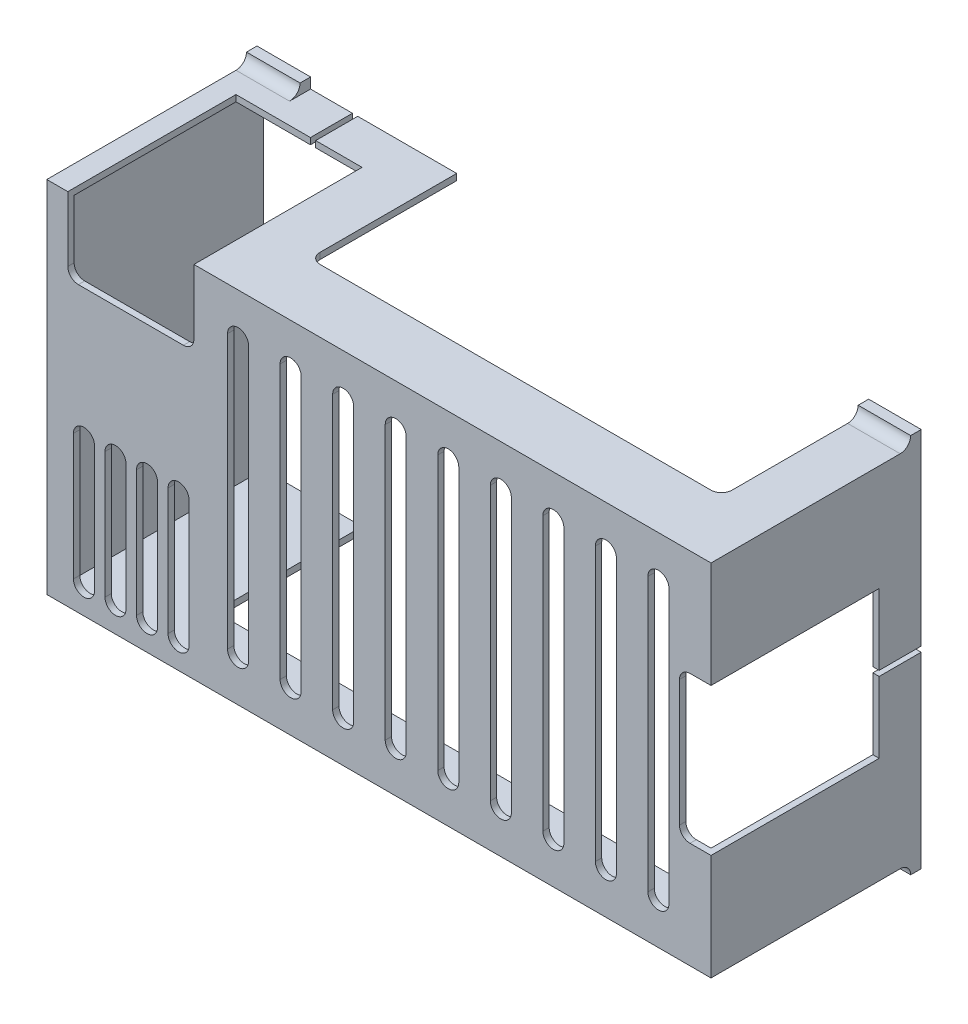
from build123d import *

# Parameters (mm, degrees)
SKETCH_1_W          = 126.4
SKETCH_1_H          = 68.4
SKETCH_1_W_2        = 124
SKETCH_1_H_2        = 66
EXTRUDE_1_DEPTH     = 40
SKETCH_2_W          = 126.4
SKETCH_2_H          = 68.4
EXTRUDE_1_2_DEPTH   = 1.2
CUT_EXTRUDE_1_DEPTH = 32
CUT_EXTRUDE_2_REACH = 84.243
CUT_EXTRUDE_3_DEPTH = 32
CUT_EXTRUDE_4_REACH = 103.355
CUT_EXTRUDE_5_REACH = 103.355
SKETCH_8_W          = 10
SKETCH_8_H          = 2
SKETCH_8_W_2        = 10.194480457
EXTRUDE_2_DEPTH     = 2
FILLET_1_R          = 2
CUT_EXTRUDE_6_REACH = 139.431
SKETCH_9_W          = 16
SKETCH_9_H          = 1
CUT_EXTRUDE_7_REACH = 104.715
SKETCH_10_W         = 1
SKETCH_10_H         = 16


with BuildPart() as part:
    # Эскиз1 → Extrude 1 (new body)
    with BuildSketch(Plane.XY):
        Rectangle(SKETCH_1_W, SKETCH_1_H)
        Rectangle(SKETCH_1_W_2, SKETCH_1_H_2, mode=Mode.SUBTRACT)
    extrude(amount=EXTRUDE_1_DEPTH)

    # Эскиз2 → Extrude 1 2 (add)
    with BuildSketch(Plane.XY.offset(40)):
        Rectangle(SKETCH_2_W, SKETCH_2_H)
    extrude(amount=-EXTRUDE_1_2_DEPTH)

    # Эскиз3 → Вырез-Вытянуть1 (cut)
    with BuildSketch(Plane.XY.offset(40)):
        with BuildLine():
            Line((59.2, -14), (69.2, -14))
            Line((69.2, -14), (69.2, 14))
            Line((69.2, 14), (59.2, 14))
            ThreePointArc((59.2, 14), (57.785786438, 13.414213562), (57.2, 12))
            Line((57.2, 12), (57.2, -12))
            ThreePointArc((57.2, -12), (57.785786438, -13.414213562), (59.2, -14))
        make_face()
    extrude(amount=-CUT_EXTRUDE_1_DEPTH, mode=Mode.SUBTRACT)

    # Эскиз4 → Вырез-Вытянуть2 (cut, up to next)
    with BuildSketch(Plane.XY.offset(40), mode=Mode.PRIVATE) as cut_extrude_2_sk1:
        with BuildLine():
            Line((51.2, -26), (51.2, 26))
            ThreePointArc((51.2, 26), (53.2, 28), (55.2, 26))
            Line((55.2, 26), (55.2, -26))
            ThreePointArc((55.2, -26), (53.2, -28), (51.2, -26))
        make_face()
    cut_extrude_2_tool1 = extrude(cut_extrude_2_sk1.sketch, amount=-CUT_EXTRUDE_2_REACH, mode=Mode.PRIVATE) & part.part
    # Эскиз4 → Вырез-Вытянуть2 (cut, up to next)
    with BuildSketch(Plane.XY.offset(40), mode=Mode.PRIVATE) as cut_extrude_2_sk2:
        with BuildLine():
            Line((41.2, -26), (41.2, 26))
            ThreePointArc((41.2, 26), (43.2, 28), (45.2, 26))
            Line((45.2, 26), (45.2, -26))
            ThreePointArc((45.2, -26), (43.2, -28), (41.2, -26))
        make_face()
    cut_extrude_2_tool2 = extrude(cut_extrude_2_sk2.sketch, amount=-CUT_EXTRUDE_2_REACH, mode=Mode.PRIVATE) & part.part
    # Эскиз4 → Вырез-Вытянуть2 (cut, up to next)
    with BuildSketch(Plane.XY.offset(40), mode=Mode.PRIVATE) as cut_extrude_2_sk3:
        with BuildLine():
            Line((31.2, -26), (31.2, 26))
            ThreePointArc((31.2, 26), (33.2, 28), (35.2, 26))
            Line((35.2, 26), (35.2, -26))
            ThreePointArc((35.2, -26), (33.2, -28), (31.2, -26))
        make_face()
    cut_extrude_2_tool3 = extrude(cut_extrude_2_sk3.sketch, amount=-CUT_EXTRUDE_2_REACH, mode=Mode.PRIVATE) & part.part
    # Эскиз4 → Вырез-Вытянуть2 (cut, up to next)
    with BuildSketch(Plane.XY.offset(40), mode=Mode.PRIVATE) as cut_extrude_2_sk4:
        with BuildLine():
            Line((21.2, -26), (21.2, 26))
            ThreePointArc((21.2, 26), (23.2, 28), (25.2, 26))
            Line((25.2, 26), (25.2, -26))
            ThreePointArc((25.2, -26), (23.2, -28), (21.2, -26))
        make_face()
    cut_extrude_2_tool4 = extrude(cut_extrude_2_sk4.sketch, amount=-CUT_EXTRUDE_2_REACH, mode=Mode.PRIVATE) & part.part
    # Эскиз4 → Вырез-Вытянуть2 (cut, up to next)
    with BuildSketch(Plane.XY.offset(40), mode=Mode.PRIVATE) as cut_extrude_2_sk5:
        with BuildLine():
            Line((11.2, -26), (11.2, 26))
            ThreePointArc((11.2, 26), (13.2, 28), (15.2, 26))
            Line((15.2, 26), (15.2, -26))
            ThreePointArc((15.2, -26), (13.2, -28), (11.2, -26))
        make_face()
    cut_extrude_2_tool5 = extrude(cut_extrude_2_sk5.sketch, amount=-CUT_EXTRUDE_2_REACH, mode=Mode.PRIVATE) & part.part
    # Эскиз4 → Вырез-Вытянуть2 (cut, up to next)
    with BuildSketch(Plane.XY.offset(40), mode=Mode.PRIVATE) as cut_extrude_2_sk6:
        with BuildLine():
            Line((1.2, -26), (1.2, 26))
            ThreePointArc((1.2, 26), (3.2, 28), (5.2, 26))
            Line((5.2, 26), (5.2, -26))
            ThreePointArc((5.2, -26), (3.2, -28), (1.2, -26))
        make_face()
    cut_extrude_2_tool6 = extrude(cut_extrude_2_sk6.sketch, amount=-CUT_EXTRUDE_2_REACH, mode=Mode.PRIVATE) & part.part
    # Эскиз4 → Вырез-Вытянуть2 (cut, up to next)
    with BuildSketch(Plane.XY.offset(40), mode=Mode.PRIVATE) as cut_extrude_2_sk7:
        with BuildLine():
            Line((-8.8, -26), (-8.8, 26))
            ThreePointArc((-8.8, 26), (-6.8, 28), (-4.8, 26))
            Line((-4.8, 26), (-4.8, -26))
            ThreePointArc((-4.8, -26), (-6.8, -28), (-8.8, -26))
        make_face()
    cut_extrude_2_tool7 = extrude(cut_extrude_2_sk7.sketch, amount=-CUT_EXTRUDE_2_REACH, mode=Mode.PRIVATE) & part.part
    # Эскиз4 → Вырез-Вытянуть2 (cut, up to next)
    with BuildSketch(Plane.XY.offset(40), mode=Mode.PRIVATE) as cut_extrude_2_sk8:
        with BuildLine():
            Line((-18.8, -26), (-18.8, 26))
            ThreePointArc((-18.8, 26), (-16.8, 28), (-14.8, 26))
            Line((-14.8, 26), (-14.8, -26))
            ThreePointArc((-14.8, -26), (-16.8, -28), (-18.8, -26))
        make_face()
    cut_extrude_2_tool8 = extrude(cut_extrude_2_sk8.sketch, amount=-CUT_EXTRUDE_2_REACH, mode=Mode.PRIVATE) & part.part
    # Эскиз4 → Вырез-Вытянуть2 (cut, up to next)
    with BuildSketch(Plane.XY.offset(40), mode=Mode.PRIVATE) as cut_extrude_2_sk9:
        with BuildLine():
            Line((-28.8, -26), (-28.8, 26))
            ThreePointArc((-28.8, 26), (-26.8, 28), (-24.8, 26))
            Line((-24.8, 26), (-24.8, -26))
            ThreePointArc((-24.8, -26), (-26.8, -28), (-28.8, -26))
        make_face()
    cut_extrude_2_tool9 = extrude(cut_extrude_2_sk9.sketch, amount=-CUT_EXTRUDE_2_REACH, mode=Mode.PRIVATE) & part.part
    # Эскиз4 → Вырез-Вытянуть2 (cut, up to next)
    with BuildSketch(Plane.XY.offset(40), mode=Mode.PRIVATE) as cut_extrude_2_sk10:
        with BuildLine():
            Line((-40.127823637, -29.1), (-40.127823637, -5.1))
            ThreePointArc((-40.127823637, -5.1), (-38.127823637, -3.1), (-36.127823637, -5.1))
            Line((-36.127823637, -5.1), (-36.127823637, -29.1))
            ThreePointArc((-36.127823637, -29.1), (-38.127823637, -31.1), (-40.127823637, -29.1))
        make_face()
    cut_extrude_2_tool10 = extrude(cut_extrude_2_sk10.sketch, amount=-CUT_EXTRUDE_2_REACH, mode=Mode.PRIVATE) & part.part
    # Эскиз4 → Вырез-Вытянуть2 (cut, up to next)
    with BuildSketch(Plane.XY.offset(40), mode=Mode.PRIVATE) as cut_extrude_2_sk11:
        with BuildLine():
            Line((-46.127823637, -29.1), (-46.127823637, -5.1))
            ThreePointArc((-46.127823637, -5.1), (-44.127823637, -3.1), (-42.127823637, -5.1))
            Line((-42.127823637, -5.1), (-42.127823637, -29.1))
            ThreePointArc((-42.127823637, -29.1), (-44.127823637, -31.1), (-46.127823637, -29.1))
        make_face()
    cut_extrude_2_tool11 = extrude(cut_extrude_2_sk11.sketch, amount=-CUT_EXTRUDE_2_REACH, mode=Mode.PRIVATE) & part.part
    # Эскиз4 → Вырез-Вытянуть2 (cut, up to next)
    with BuildSketch(Plane.XY.offset(40), mode=Mode.PRIVATE) as cut_extrude_2_sk12:
        with BuildLine():
            Line((-52.127823637, -29.1), (-52.127823637, -5.1))
            ThreePointArc((-52.127823637, -5.1), (-50.127823637, -3.1), (-48.127823637, -5.1))
            Line((-48.127823637, -5.1), (-48.127823637, -29.1))
            ThreePointArc((-48.127823637, -29.1), (-50.127823637, -31.1), (-52.127823637, -29.1))
        make_face()
    cut_extrude_2_tool12 = extrude(cut_extrude_2_sk12.sketch, amount=-CUT_EXTRUDE_2_REACH, mode=Mode.PRIVATE) & part.part
    # Эскиз4 → Вырез-Вытянуть2 (cut, up to next)
    with BuildSketch(Plane.XY.offset(40), mode=Mode.PRIVATE) as cut_extrude_2_sk13:
        with BuildLine():
            Line((-58.127823637, -29.1), (-58.127823637, -5.1))
            ThreePointArc((-58.127823637, -5.1), (-56.127823637, -3.1), (-54.127823637, -5.1))
            Line((-54.127823637, -5.1), (-54.127823637, -29.1))
            ThreePointArc((-54.127823637, -29.1), (-56.127823637, -31.1), (-58.127823637, -29.1))
        make_face()
    cut_extrude_2_tool13 = extrude(cut_extrude_2_sk13.sketch, amount=-CUT_EXTRUDE_2_REACH, mode=Mode.PRIVATE) & part.part
    add(cut_extrude_2_tool1.solids().sort_by_distance((53.2, 0, 40))[0], mode=Mode.SUBTRACT)
    add(cut_extrude_2_tool2.solids().sort_by_distance((43.2, 0, 40))[0], mode=Mode.SUBTRACT)
    add(cut_extrude_2_tool3.solids().sort_by_distance((33.2, 0, 40))[0], mode=Mode.SUBTRACT)
    add(cut_extrude_2_tool4.solids().sort_by_distance((23.2, 0, 40))[0], mode=Mode.SUBTRACT)
    add(cut_extrude_2_tool5.solids().sort_by_distance((13.2, 0, 40))[0], mode=Mode.SUBTRACT)
    add(cut_extrude_2_tool6.solids().sort_by_distance((3.2, 0, 40))[0], mode=Mode.SUBTRACT)
    add(cut_extrude_2_tool7.solids().sort_by_distance((-6.8, 0, 40))[0], mode=Mode.SUBTRACT)
    add(cut_extrude_2_tool8.solids().sort_by_distance((-16.8, 0, 40))[0], mode=Mode.SUBTRACT)
    add(cut_extrude_2_tool9.solids().sort_by_distance((-26.8, 0, 40))[0], mode=Mode.SUBTRACT)
    add(cut_extrude_2_tool10.solids().sort_by_distance((-38.127824, -17.1, 40))[0], mode=Mode.SUBTRACT)
    add(cut_extrude_2_tool11.solids().sort_by_distance((-44.127824, -17.1, 40))[0], mode=Mode.SUBTRACT)
    add(cut_extrude_2_tool12.solids().sort_by_distance((-50.127824, -17.1, 40))[0], mode=Mode.SUBTRACT)
    add(cut_extrude_2_tool13.solids().sort_by_distance((-56.127824, -17.1, 40))[0], mode=Mode.SUBTRACT)

    # Эскиз5 → Вырез-Вытянуть3 (cut)
    with BuildSketch(Plane.XY.offset(40)):
        with BuildLine():
            Line((-59.2, 48.521499027), (-35.2, 48.521499027))
            Line((-35.2, 48.521499027), (-35.2, 21.878500973))
            ThreePointArc((-35.2, 21.878500973), (-35.785786438, 20.46428741), (-37.2, 19.878500973))
            Line((-37.2, 19.878500973), (-57.2, 19.878500973))
            ThreePointArc((-57.2, 19.878500973), (-58.614213562, 20.46428741), (-59.2, 21.878500973))
            Line((-59.2, 21.878500973), (-59.2, 48.521499027))
        make_face()
    extrude(amount=-CUT_EXTRUDE_3_DEPTH, mode=Mode.SUBTRACT)

    # Эскиз6 → Вырез-Вытянуть4 (cut, up to next)
    with BuildSketch(Plane.XZ.offset(34.2), mode=Mode.PRIVATE) as cut_extrude_4_sk1:
        with BuildLine():
            Line((53.2, 0), (-43.2, 0))
            Line((-43.2, 0), (-43.2, 26))
            ThreePointArc((-43.2, 26), (-42.614213562, 27.414213562), (-41.2, 28))
            Line((-41.2, 28), (51.2, 28))
            ThreePointArc((51.2, 28), (52.614213562, 27.414213562), (53.2, 26))
            Line((53.2, 26), (53.2, 0))
        make_face()
    cut_extrude_4_tool1 = extrude(cut_extrude_4_sk1.sketch, amount=-CUT_EXTRUDE_4_REACH, mode=Mode.PRIVATE) & part.part
    add(cut_extrude_4_tool1.solids().sort_by_distance((5, -34.2, 13.991374))[0], mode=Mode.SUBTRACT)

    # Эскиз7 → Вырез-Вытянуть5 (cut, up to next)
    with BuildSketch(Plane(origin=(0, 34.2, 0), x_dir=(1, 0, 0), z_dir=(0, 1, 0)), mode=Mode.PRIVATE) as cut_extrude_5_sk1:
        with BuildLine():
            Line((53.2, 0), (-25.2, 0))
            Line((-25.2, 0), (-25.2, -26))
            ThreePointArc((-25.2, -26), (-24.614213562, -27.414213562), (-23.2, -28))
            Line((-23.2, -28), (51.2, -28))
            ThreePointArc((51.2, -28), (52.614213562, -27.414213562), (53.2, -26))
            Line((53.2, -26), (53.2, 0))
        make_face()
    cut_extrude_5_tool1 = extrude(cut_extrude_5_sk1.sketch, amount=-CUT_EXTRUDE_5_REACH, mode=Mode.PRIVATE) & part.part
    add(cut_extrude_5_tool1.solids().sort_by_distance((14, 34.2, 13.989392))[0], mode=Mode.SUBTRACT)

    # Эскиз8 → Бобышка-Вытянуть2 (add)
    with BuildSketch(Plane(origin=(0, 0, 0), x_dir=(-1, 0, 0), z_dir=(0, 0, -1))):
        with Locations((-58.2, 35.2)):
            Rectangle(SKETCH_8_W, SKETCH_8_H)
        with Locations((-58.2, -35.2)):
            Rectangle(SKETCH_8_W, SKETCH_8_H)
        with Locations((58.102759772, 35.2)):
            Rectangle(SKETCH_8_W_2, SKETCH_8_H)
        with Locations((58.102759772, -35.2)):
            Rectangle(SKETCH_8_W_2, SKETCH_8_H)
    extrude(amount=-EXTRUDE_2_DEPTH)

    # Скругление1
    fillet_1_edges = [part.edges().sort_by_distance(p)[0] for p in [
        (-58.102759771, -34.2, 2),
        (58.2, -34.2, 2),
        (58.2, 34.2, 2),
        (-58.102759771, 34.2, 2),
    ]]
    fillet(fillet_1_edges, radius=FILLET_1_R - 0.0001)  # a hair under: the kernel refuses the full size

    # Эскиз9 → Вырез-Вытянуть6 (cut, up to next)
    with BuildSketch(Plane(origin=(63.2, 0, 0), x_dir=(0, 0, -1), z_dir=(1, 0, 0)), mode=Mode.PRIVATE) as cut_extrude_6_sk1:
        Rectangle(SKETCH_9_W, SKETCH_9_H)
    cut_extrude_6_tool1 = extrude(cut_extrude_6_sk1.sketch, amount=-CUT_EXTRUDE_6_REACH, mode=Mode.PRIVATE) & part.part
    add(cut_extrude_6_tool1.solids().sort_by_distance((63.2, 0, 0))[0], mode=Mode.SUBTRACT)

    # Эскиз10 → Вырез-Вытянуть7 (cut, up to next)
    with BuildSketch(Plane(origin=(0, 34.2, 0), x_dir=(1, 0, 0), z_dir=(0, 1, 0)), mode=Mode.PRIVATE) as cut_extrude_7_sk1:
        with Locations((-44.530737739, 0)):
            Rectangle(SKETCH_10_W, SKETCH_10_H)
    cut_extrude_7_tool1 = extrude(cut_extrude_7_sk1.sketch, amount=-CUT_EXTRUDE_7_REACH, mode=Mode.PRIVATE) & part.part
    add(cut_extrude_7_tool1.solids().sort_by_distance((-44.530738, 34.2, 0))[0], mode=Mode.SUBTRACT)


solid = part.part
